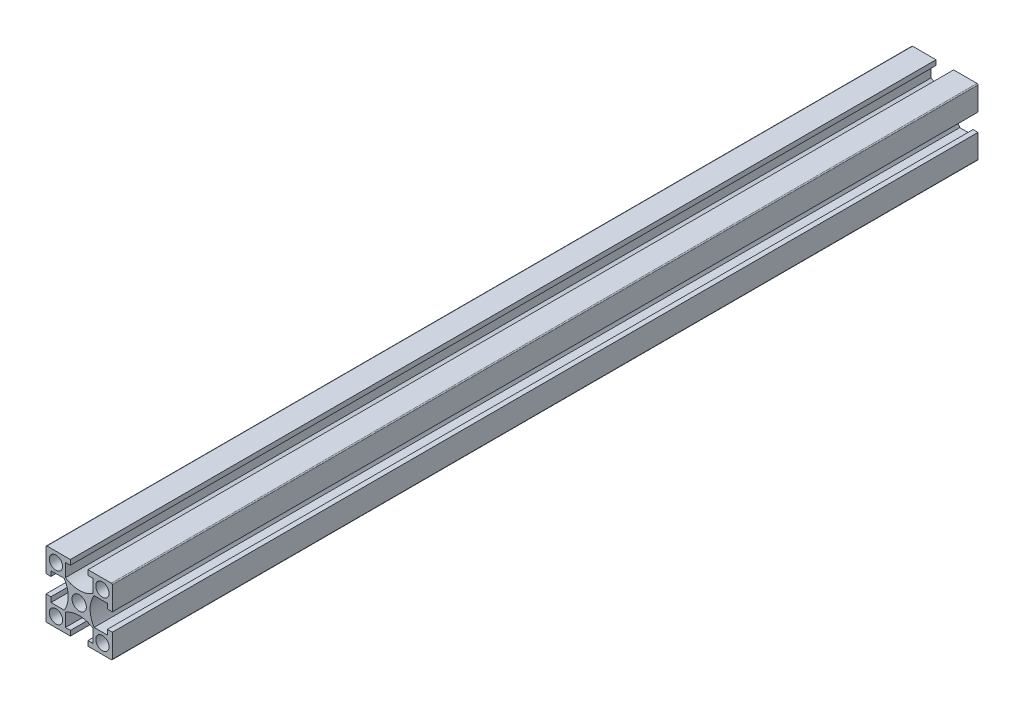
from build123d import *

# Parameters (mm, degrees)
SKETCH_1_W               = 20
SKETCH_1_H               = 20
SKETCH_1_R               = 2
SKETCH_1_R_2             = 2.15
EXTRUDE_1_DEPTH          = 261
CUT_EXTRUDE_1_REACH      = 263.383
PATTERN_CIRCULAR_1_COUNT = 4
FILLET_1_R               = 0.3
SKETCH_3_R               = 2.5
CUT_EXTRUDE_2_DEPTH      = 262.956103193
SKETCH_4_R               = 2.15
CUT_EXTRUDE_3_DEPTH      = 262.956103293


with BuildPart() as part:
    # 스케치1 → 보스-돌출1 (new body)
    with BuildSketch(Plane.XY):
        Rectangle(SKETCH_1_W, SKETCH_1_H)
        with Locations((-7, -7)):
            Circle(SKETCH_1_R, mode=Mode.SUBTRACT)
        with Locations((7, -7)):
            Circle(SKETCH_1_R, mode=Mode.SUBTRACT)
        with Locations((-7, 7)):
            Circle(SKETCH_1_R, mode=Mode.SUBTRACT)
        Circle(SKETCH_1_R_2, mode=Mode.SUBTRACT)
        with Locations((7, 7)):
            Circle(SKETCH_1_R, mode=Mode.SUBTRACT)
    extrude(amount=EXTRUDE_1_DEPTH)

    # 스케치1<3> → 컷-돌출1 (cut, up to next)
    with BuildSketch(Plane.XY, mode=Mode.PRIVATE) as cut_extrude_1_sk1:
        with BuildLine():
            Line((-8.5, 2.65), (-10, 2.65))
            Line((-10, 2.65), (-10, -2.65))
            Line((-10, -2.65), (-8.5, -2.65))
            Line((-8.5, -2.65), (-8.5, -4.15))
            Line((-8.5, -4.15), (-4.503166667, -4.15))
            ThreePointArc((-4.503166667, -4.15), (-3.3, 0), (-4.503166667, 4.15))
            Line((-4.503166667, 4.15), (-8.5, 4.15))
            Line((-8.5, 4.15), (-8.5, 2.65))
        make_face()
    cut_extrude_1_tool1 = extrude(cut_extrude_1_sk1.sketch, amount=CUT_EXTRUDE_1_REACH, mode=Mode.PRIVATE) & part.part
    cut_extrude_1 = cut_extrude_1_tool1.solids().sort_by_distance((-6.606913, 0, 0))[0]
    add(cut_extrude_1, mode=Mode.SUBTRACT)

    # 원형 패턴1: 컷-돌출1 ×4 about axis
    pattern_circular_1_axis = Axis((0, 0, 261), (0, 0, -1))
    for i in range(1, PATTERN_CIRCULAR_1_COUNT):
        add(cut_extrude_1.rotate(pattern_circular_1_axis, i * 360 / PATTERN_CIRCULAR_1_COUNT), mode=Mode.SUBTRACT)

    # 필렛1
    fillet_1_edges = [part.edges().sort_by_distance(p)[0] for p in [
        (10, -10, 130.5),
        (-10, -10, 130.5),
        (-10, 10, 130.5),
        (10, 10, 130.5),
    ]]
    fillet(fillet_1_edges, radius=FILLET_1_R)

    # 스케치3 → 컷-돌출2 (cut, through all)
    with BuildSketch(Plane(origin=(0, 10, 0), x_dir=(1, 0, 0), z_dir=(0, 1, 0))):
        with Locations((0, -11)):
            Circle(SKETCH_3_R)
        with Locations((0, -250)):
            Circle(SKETCH_3_R)
    extrude(amount=-CUT_EXTRUDE_2_DEPTH, mode=Mode.SUBTRACT)

    # 스케치4 → 컷-돌출3 (cut, through all)
    with BuildSketch(Plane(origin=(0, 10, 0), x_dir=(1, 0, 0), z_dir=(0, 1, 0))):
        with Locations((0, -108)):
            Circle(SKETCH_4_R)
        with Locations((0, -160)):
            Circle(SKETCH_4_R)
    extrude(amount=-CUT_EXTRUDE_3_DEPTH, mode=Mode.SUBTRACT)


solid = part.part
